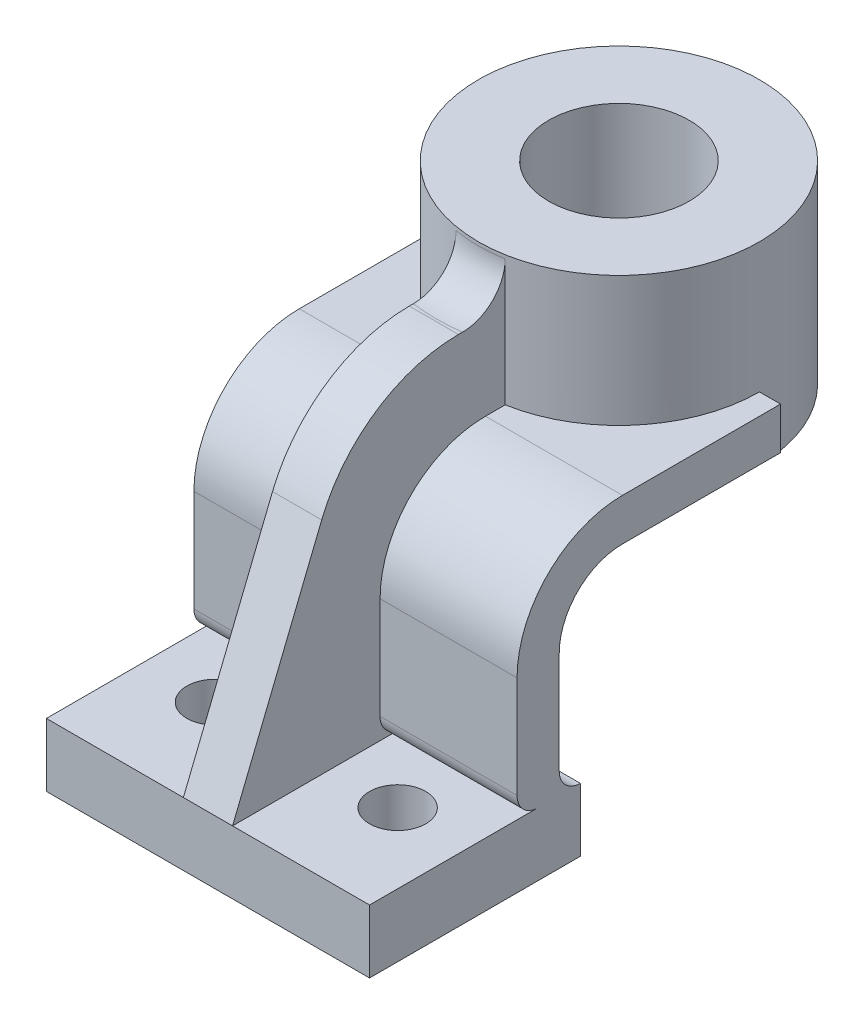
from build123d import *

# Parameters (mm, degrees)
CROQUIS1_W                   = 92
CROQUIS1_H                   = 60
SALIENTE_EXTRUIR1_DEPTH      = 18
CROQUIS2_R                   = 8
CORTAR_EXTRUIR1_DEPTH        = 15
SALIENTE_EXTRUIR2_DEPTH      = 92
REDONDEO1_R                  = 6
SALIENTE_EXTRUIR4_DEPTH      = 37
SALIENTE_EXTRUIR4_DEPTH_BACK = 18
CROQUIS4_R                   = 40
CROQUIS5_R                   = 20
CORTAR_EXTRUIR2_DEPTH        = 181.679273853
NERVIO1_START                = -7
NERVIO1_DEPTH                = 14
REDONDEO2_R                  = 42
REDONDEO3_R                  = 12


# Read off the part's stored shape, not the designer's step: Nervio1
with BuildPart() as part:
    # Croquis1 → Saliente-Extruir1 (new body)
    with BuildSketch(Plane(origin=(0, 0, 0), x_dir=(1, 0, 0), z_dir=(0, 1, 0))):
        Rectangle(CROQUIS1_W, CROQUIS1_H)
    extrude(amount=SALIENTE_EXTRUIR1_DEPTH)

    # Croquis2 → Cortar-Extruir1 (cut)
    with BuildSketch(Plane(origin=(0, 18, 0), x_dir=(1, 0, 0), z_dir=(0, 1, 0))):
        with Locations(Location((26, -2, 0), (0, 0, 270))):
            Circle(CROQUIS2_R)
        with Locations(Location((-26, -2, 0), (0, 0, 90))):
            Circle(CROQUIS2_R)
    extrude(amount=-CORTAR_EXTRUIR1_DEPTH, mode=Mode.SUBTRACT)

    # Croquis3 → Saliente-Extruir2 (add, through all)
    with BuildSketch(Plane(origin=(46, 0, 0), x_dir=(0, 0, -1), z_dir=(1, 0, 0))):
        with BuildLine():
            Line((18, 18), (24, 18))
            Line((24, 18), (24, 53))
            ThreePointArc((24, 53), (29.272077939, 65.727922061), (42, 71))
            Line((42, 71), (87, 71))
            Line((87, 71), (87, 83))
            Line((87, 83), (42, 83))
            ThreePointArc((42, 83), (20.786796564, 74.213203436), (12, 53))
            Line((12, 53), (12, 24))
            ThreePointArc((12, 24), (13.757359313, 19.757359313), (18, 18))
        make_face()
    extrude(amount=-SALIENTE_EXTRUIR2_DEPTH)

    # Redondeo1
    redondeo1_edges = [part.edges().sort_by_distance(p)[0] for p in [
        (0, 18, -24),
    ]]
    fillet(redondeo1_edges, radius=REDONDEO1_R - 0.0001)  # a hair under: the kernel refuses the full size

    # Croquis4 → Saliente-Extruir4 (add, two sides: drawn at the far end of the back side and taken through both)
    with BuildSketch(Plane(origin=(0, 83, 0), x_dir=(1, 0, 0), z_dir=(0, 1, 0)).offset(-SALIENTE_EXTRUIR4_DEPTH_BACK)):
        with Locations(Location((0, 87, 0), (0, 0, 270))):
            Circle(CROQUIS4_R)
    extrude(amount=SALIENTE_EXTRUIR4_DEPTH + SALIENTE_EXTRUIR4_DEPTH_BACK)

    # Croquis5 → Cortar-Extruir2 (cut, through all)
    with BuildSketch(Plane(origin=(0, 120, 0), x_dir=(1, 0, 0), z_dir=(0, 1, 0))):
        with Locations(Location((0, 87, 0), (0, 0, 270))):
            Circle(CROQUIS5_R)
    extrude(amount=-CORTAR_EXTRUIR2_DEPTH, mode=Mode.SUBTRACT)

    # Nervio1 outline → Nervio1 (add)
    with BuildSketch(Plane(origin=(0, 0, 0), x_dir=(0, 0, -1), z_dir=(1, 0, 0)).offset(NERVIO1_START)):
        with BuildLine():
            Line((42, 83), (48, 83))
            Line((48, 83), (48, 107))
            Line((48, 107), (6, 107))
            Line((6, 107), (-30, 18))
            Line((-30, 18), (18, 18))
            ThreePointArc((18, 18), (13.757359313, 19.757359313), (12, 24))
            Line((12, 24), (12, 53))
            ThreePointArc((12, 53), (20.786796564, 74.213203436), (42, 83))
        make_face()
    extrude(amount=NERVIO1_DEPTH)

    # Redondeo2
    redondeo2_edges = [part.edges().sort_by_distance(p)[0] for p in [
        (0, 107, -6),
    ]]
    fillet(redondeo2_edges, radius=REDONDEO2_R)

    # Redondeo3
    redondeo3_edges = [part.edges().sort_by_distance(p)[0] for p in [
        (-3.513581264, 107, -47.154614487),
    ]]
    fillet(redondeo3_edges, radius=REDONDEO3_R)


solid = part.part
